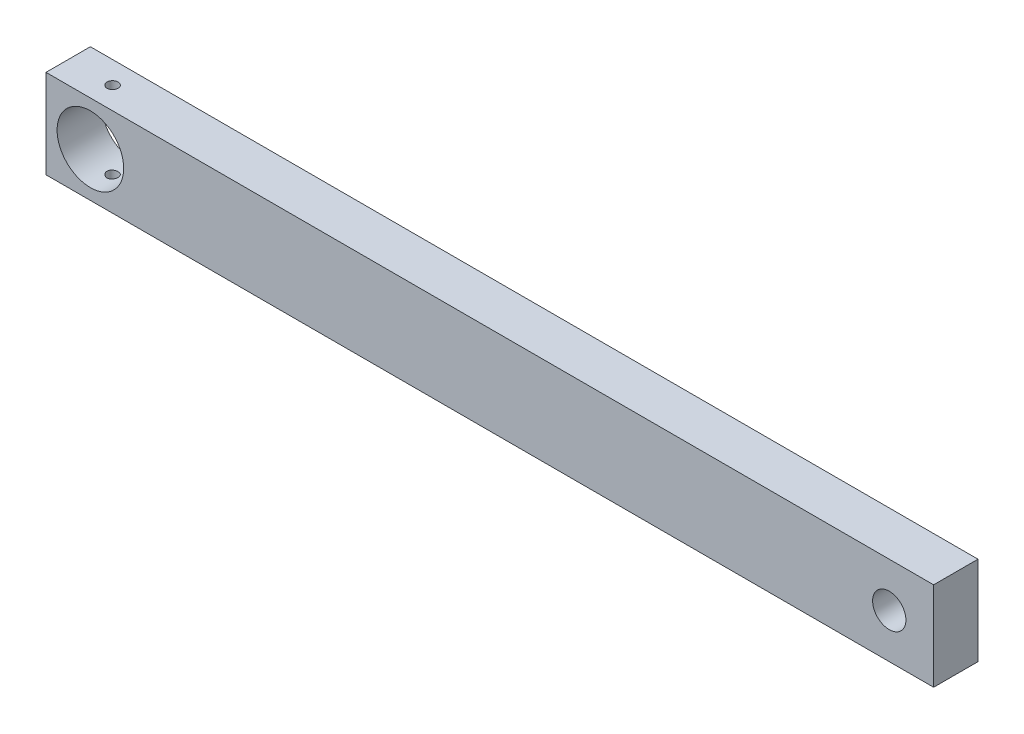
from build123d import *

# Parameters (mm, degrees)
SKETCH1_W           = 127
SKETCH1_H           = 12.7
SKETCH1_R           = 4.7625
SKETCH1_R_2         = 2.38125
BOSS_EXTRUDE1_DEPTH = 6.35
SKETCH2_R           = 0.7874
CUT_EXTRUDE1_DEPTH  = 12.7


with BuildPart() as part:
    # Sketch1 → Boss-Extrude1 (new body)
    with BuildSketch(Plane.XY):
        with Locations((63.5, 6.35)):
            Rectangle(SKETCH1_W, SKETCH1_H)
        with Locations((6.35, 6.35)):
            Circle(SKETCH1_R, mode=Mode.SUBTRACT)
        with Locations((120.65, 6.35)):
            Circle(SKETCH1_R_2, mode=Mode.SUBTRACT)
    extrude(amount=BOSS_EXTRUDE1_DEPTH)

    # Sketch2 → Cut-Extrude1 (cut)
    with BuildSketch(Plane(origin=(0, 12.7, 0), x_dir=(1, 0, 0), z_dir=(0, 1, 0))):
        with Locations((6.35, -3.175)):
            Circle(SKETCH2_R)
    extrude(amount=-CUT_EXTRUDE1_DEPTH, mode=Mode.SUBTRACT)


solid = part.part
